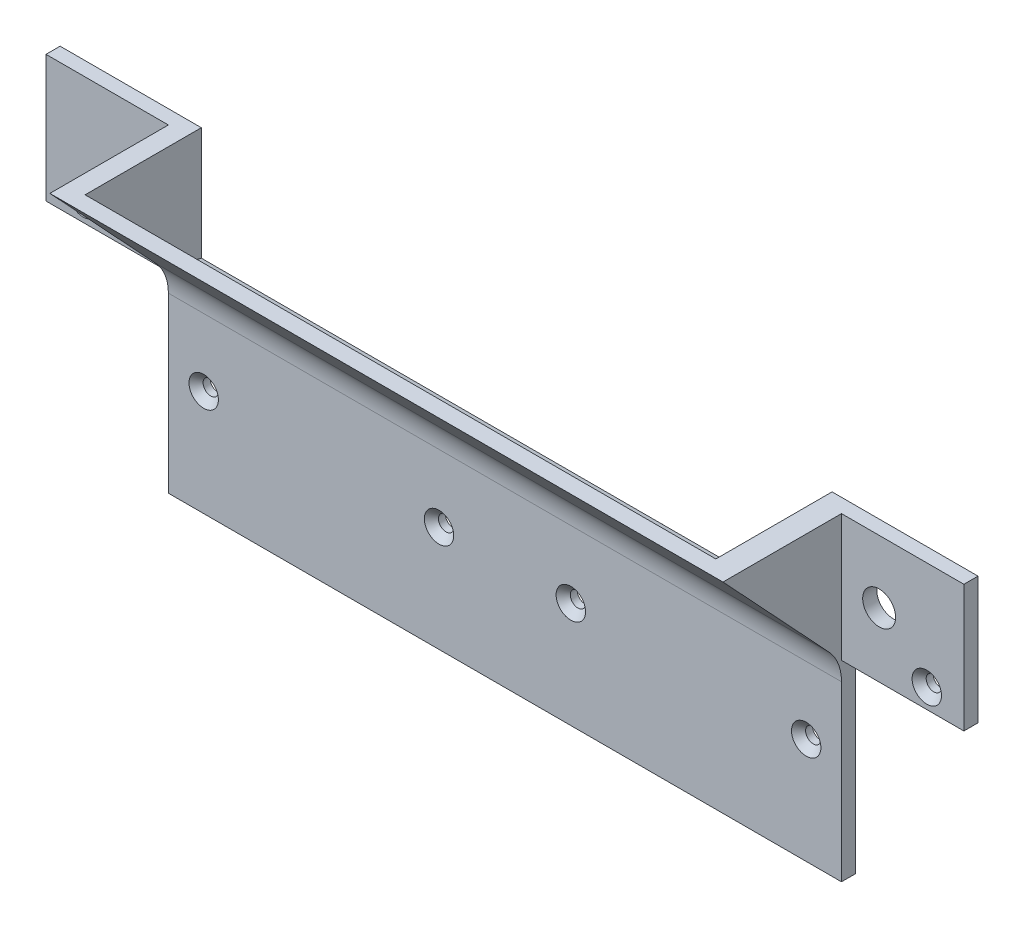
from build123d import *

# Parameters (mm, degrees)
CROQUIS1_R                  = 1.625
SALIENTE_EXTRUIR1_DEPTH     = 3
CROQUIS2_W                  = 143
CROQUIS2_H                  = 24
SALIENTE_EXTRUIR2_DEPTH     = 13
CORTAR_EXTRUIR1_START       = -4
CORTAR_EXTRUIR1_DEPTH       = 134
CORTAR_EXTRUIR2_DEPTH       = 183.316345948
CORTAR_EXTRUIR2_DEPTH_BACK  = 183.316345948
SALIENTE_EXTRUIR3_DEPTH     = 1
CHAFL_N1_SIZE               = 1.5
CROQUIS7_R                  = 6
CORTAR_EXTRUIR3_DEPTH       = 10
CROQUIS11_R                 = 5
CORTAR_EXTRUIR7_DEPTH       = 60
CORTAR_EXTRUIR8_DEPTH       = 183.40682554
CORTAR_EXTRUIR8_DEPTH_BACK  = 183.40682554
CROQUIS12_W                 = 39.754544999
CROQUIS12_H                 = 27.919936099
CORTAR_EXTRUIR9_DEPTH       = 119.057189531
CORTAR_EXTRUIR9_DEPTH_BACK  = 119.057189531
CROQUIS13_W                 = 134.117881028
CROQUIS13_H                 = 3.734427539
CORTAR_EXTRUIR10_DEPTH      = 207.049144623
CORTAR_EXTRUIR10_DEPTH_BACK = 207.049144623
CROQUIS14_W                 = 4.069621889
CROQUIS14_H                 = 4.224509549
CROQUIS22_W                 = 31
CROQUIS22_H                 = 6.734427539
SALIENTE_EXTRUIR9_DEPTH     = 3
CROQUIS23_W                 = 15.138367264
CROQUIS23_H                 = 34.152206442
CORTAR_EXTRUIR11_DEPTH      = 10
SALIENTE_EXTRUIR4_START     = -5
SALIENTE_EXTRUIR4_DEPTH     = 5
SALIENTE_EXTRUIR5_START     = -4
SALIENTE_EXTRUIR5_DEPTH     = 4
SALIENTE_EXTRUIR6_START     = -138
SALIENTE_EXTRUIR6_DEPTH     = 134
CROQUIS18_R                 = 6
SALIENTE_EXTRUIR7_DEPTH     = 3
REDONDEO1_R                 = 10
CROQUIS19_R                 = 5
CROQUIS19_R_2               = 3.25
CROQUIS19_R_3               = 3.5
SALIENTE_EXTRUIR8_DEPTH     = 3


with BuildPart() as part:
    # Croquis1 → Saliente-Extruir1 (new body)
    with BuildSketch(Plane.XY):
        Polygon((-97.5, -1.75), (-97.5, -25.75), (-71.5, -25.75), (-71.5, -66.5), (71.5, -66.5), (71.5, -25.75), (97.5, -25.75), (97.5, -1.75), align=None)
        with Locations((-89.62, -21.62)):
            Circle(CROQUIS1_R, mode=Mode.SUBTRACT)
        with Locations((-64, -44)):
            Circle(CROQUIS1_R, mode=Mode.SUBTRACT)
        with Locations((-14, -44)):
            Circle(CROQUIS1_R, mode=Mode.SUBTRACT)
        with Locations(Location((14, -44, 0), (0, 0, 180))):
            Circle(CROQUIS1_R, mode=Mode.SUBTRACT)
        with Locations(Location((64, -44, 0), (0, 0, 180))):
            Circle(CROQUIS1_R, mode=Mode.SUBTRACT)
        with Locations(Location((89.62, -21.62, 0), (0, 0, 180))):
            Circle(CROQUIS1_R, mode=Mode.SUBTRACT)
    extrude(amount=SALIENTE_EXTRUIR1_DEPTH)

    # Croquis2 → Saliente-Extruir2 (add)
    with BuildSketch(Plane.XY.offset(3)):
        with Locations((0, -13.75)):
            Rectangle(CROQUIS2_W, CROQUIS2_H)
    extrude(amount=SALIENTE_EXTRUIR2_DEPTH)

    # Croquis4 → Cortar-Extruir1 (cut)
    with BuildSketch(Plane.ZY.offset(71.5).offset(CORTAR_EXTRUIR1_START)):
        Polygon((0, -22.75), (12.254442441, -19.75), (12.254442441, -7.75), (0, -4.75), align=None)
    extrude(amount=-CORTAR_EXTRUIR1_DEPTH, mode=Mode.SUBTRACT)

    # Croquis5 → Cortar-Extruir2 (cut, two sides: drawn at the far end of the back side and taken through both)
    with BuildSketch(Plane.ZY.offset(71.5).offset(-CORTAR_EXTRUIR2_DEPTH_BACK)):
        Polygon((3, -25.75), (16, -22.567480666), (16, -5.666946873), (0, -1.75), (13.126652557, 3.411104472), (22.490929508, -3.111277484), (22.490929508, -28.232984682), align=None)
    extrude(amount=CORTAR_EXTRUIR2_DEPTH + CORTAR_EXTRUIR2_DEPTH_BACK, mode=Mode.SUBTRACT)

    # Croquis6 → Saliente-Extruir3 (add)
    # profile 1 of 3: a face of its own
    with BuildSketch(Plane.XY.offset(16)):
        with BuildLine():
            Line((-11.048076923, -8.067480666), (-8.963942308, -8.067480666))
            add(Edge.make_bspline(
                [(-8.963942308, -8.067480666), (-8.809276988, -8.068112716), (-8.511063659, -8.069331385), (-8.082223191, -8.086660848), (-7.688620597, -8.112805667), (-7.330723888, -8.147308935), (-7.008234257, -8.195180289), (-6.72182234, -8.25265944), (-6.469658762, -8.316670483), (-6.318437154, -8.376153718), (-6.247596154, -8.404019127)],
                knots=[0, 0, 0, 0, 1.348808202, 2.600664361, 3.742342956, 4.788858012, 5.735658768, 6.584006912, 7.336666444, 8, 8, 8, 8], degree=3))
            add(Edge.make_bspline(
                [(-6.247596154, -8.404019127), (-6.167838297, -8.439986111), (-6.01192431, -8.510295871), (-5.788508653, -8.62947523), (-5.57929728, -8.757863745), (-5.387757493, -8.900302082), (-5.209847212, -9.050792623), (-5.046669639, -9.210766732), (-4.899538696, -9.382679515), (-4.766910273, -9.563447492), (-4.648977655, -9.752836862), (-4.547744652, -9.951781558), (-4.460210228, -10.158597262), (-4.391853098, -10.375534491), (-4.335040106, -10.599989157), (-4.298295523, -10.833377416), (-4.27243642, -11.07491201), (-4.270311593, -11.238882429), (-4.269230769, -11.322288358)],
                knots=[0, 0, 0, 0, 1.116361014, 2.182309107, 3.229450697, 4.24598407, 5.225421932, 6.201651319, 7.158895679, 8.110002388, 9.060669178, 10.002827475, 10.956240434, 11.923213192, 12.902917952, 13.908279153, 14.936015885, 16, 16, 16, 16], degree=3))
            add(Edge.make_bspline(
                [(-4.269230769, -11.322288358), (-4.271772595, -11.424925094), (-4.276790571, -11.627546629), (-4.309579081, -11.926339339), (-4.370733726, -12.213061963), (-4.453090589, -12.488617706), (-4.555124128, -12.754790758), (-4.686709728, -13.006949511), (-4.838806317, -13.249487522), (-5.014462356, -13.47922496), (-5.210800272, -13.698269295), (-5.437501776, -13.893729522), (-5.68202542, -14.078750894), (-5.954416581, -14.240928545), (-6.247183828, -14.39157714), (-6.567004768, -14.519215786), (-6.907876863, -14.637006555), (-7.14689016, -14.695959195), (-7.269230769, -14.726134512)],
                knots=[0, 0, 0, 0, 0.995453645, 1.965186658, 2.910129054, 3.83459069, 4.752398018, 5.669942118, 6.588407184, 7.525617038, 8.471772905, 9.435289717, 10.423772802, 11.441988612, 12.505459691, 13.613754905, 14.778583949, 16, 16, 16, 16], degree=3))
            Line((-7.269230769, -14.726134512), (-4.5, -20.067480666))
            Line((-4.5, -20.067480666), (-6.90625, -20.067480666))
            Line((-6.90625, -20.067480666), (-9.617788462, -14.836711435))
            Line((-9.617788462, -14.836711435), (-9.822115385, -14.836711435))
            Line((-9.822115385, -14.836711435), (-10.557692308, -20.067480666))
            Line((-10.557692308, -20.067480666), (-12.730769231, -20.067480666))
            Line((-12.730769231, -20.067480666), (-11.048076923, -8.067480666))
        make_face()
        with BuildLine():
            add(Edge.make_bspline(
                [(-9.540865385, -12.836711435), (-9.386195416, -12.835275241), (-9.090350679, -12.832528164), (-8.667825913, -12.813420248), (-8.28680605, -12.783236682), (-7.948389952, -12.740102395), (-7.651687406, -12.689090143), (-7.397958815, -12.625404989), (-7.186041205, -12.549684501), (-7.012592097, -12.459887562), (-6.872086372, -12.354457197), (-6.750472631, -12.241946473), (-6.649207312, -12.116003172), (-6.565654347, -11.978741621), (-6.5012127, -11.829877316), (-6.454740309, -11.668401722), (-6.429045355, -11.495391495), (-6.425095306, -11.376054994), (-6.423076923, -11.31507682)],
                knots=[0, 0, 0, 0, 1.892208387, 3.619318591, 5.173427176, 6.566868293, 7.791773198, 8.8545744, 9.763297566, 10.539470204, 11.233547833, 11.906251103, 12.5615143, 13.203742025, 13.866659999, 14.539934446, 15.25394049, 16, 16, 16, 16], degree=3))
            add(Edge.make_bspline(
                [(-6.423076923, -11.31507682), (-6.425689641, -11.245936375), (-6.430757957, -11.11181339), (-6.474596815, -10.918637614), (-6.549559753, -10.743400948), (-6.654909947, -10.587778732), (-6.786381326, -10.450558767), (-6.946769202, -10.337542298), (-7.134240875, -10.248576591), (-7.309857115, -10.189799645), (-7.476087089, -10.155754532), (-7.631045454, -10.132880777), (-7.814511833, -10.110808419), (-8.027038079, -10.094486606), (-8.26836871, -10.083690031), (-8.538380856, -10.073198835), (-8.836529796, -10.069468107), (-9.044872334, -10.068163199), (-9.153846154, -10.067480666)],
                knots=[0, 0, 0, 0, 0.974340854, 1.890087692, 2.776057671, 3.647490651, 4.526730822, 5.442477659, 6.397820337, 7.445016909, 8.045730266, 8.789007992, 9.653967296, 10.651691253, 11.794598421, 13.061237498, 14.462876682, 16, 16, 16, 16], degree=3))
            Line((-9.153846154, -10.067480666), (-9.540865385, -12.836711435))
        make_face(mode=Mode.SUBTRACT)
    # profile 2 of 3: a face of its own
    with BuildSketch(Plane.XY.offset(16)):
        Polygon((1.884615385, -8.067480666), (4.180288462, -8.067480666), (6.012019231, -12.807865281), (9.425480769, -8.067480666), (12.033653846, -8.067480666), (6.838942308, -15.28382682), (6.209134615, -20.067480666), (4.038461538, -20.067480666), (4.670673077, -15.271807589), align=None)
    # profile 3 of 3: a face of its own
    with BuildSketch(Plane.XY.offset(16)):
        with BuildLine():
            add(Edge.make_bspline(
                [(24.487980769, -7.759788358), (24.690145883, -7.764031221), (25.087091072, -7.772361955), (25.668927957, -7.849024893), (26.224011967, -7.972589701), (26.750990661, -8.149778703), (27.251887383, -8.373625801), (27.725496832, -8.64948879), (28.171301864, -8.975420649), (28.585672586, -9.347005104), (28.961013577, -9.756424421), (29.293862045, -10.194630861), (29.570289093, -10.663617643), (29.797934343, -11.158162459), (29.977385898, -11.67880605), (30.099797668, -12.228050386), (30.180599156, -12.802256134), (30.188356974, -13.194600078), (30.192307692, -13.394403743)],
                knots=[0, 0, 0, 0, 1.079937363, 2.120424901, 3.130164457, 4.114608815, 5.086352068, 6.057283592, 7.037967613, 8.032612779, 9.026667848, 10.002130715, 10.967845321, 11.92966918, 12.907375778, 13.904589319, 14.932898699, 16, 16, 16, 16], degree=3))
            add(Edge.make_bspline(
                [(30.192307692, -13.394403743), (30.189777514, -13.549969057), (30.184745184, -13.859376411), (30.136860197, -14.319433848), (30.062261858, -14.772962365), (29.960118985, -15.22009286), (29.823390606, -15.659391242), (29.660180669, -16.093460312), (29.46547734, -16.520524116), (29.241871054, -16.937274794), (28.996915489, -17.338803359), (28.7284292, -17.718478392), (28.439993147, -18.074046587), (28.132714318, -18.406907786), (27.803274713, -18.712605848), (27.458113362, -18.997544901), (27.089752961, -19.255248214), (26.704041226, -19.490638964), (26.300172025, -19.699838611), (25.880874397, -19.880651571), (25.446694054, -20.031827723), (24.998656183, -20.156810905), (24.535654153, -20.256242446), (24.057773688, -20.324929749), (23.564847151, -20.366615352), (23.231652765, -20.37229141), (23.0625, -20.375172973)],
                knots=[0, 0, 0, 0, 1.005311864, 1.999487392, 2.986390894, 3.975195422, 4.961487101, 5.958115224, 6.97104375, 7.992937587, 9.013623077, 10.009524137, 10.996414046, 11.971324635, 12.935123389, 13.899409138, 14.862205298, 15.838449601, 16.81836937, 17.799766407, 18.787539403, 19.787875373, 20.804768927, 21.846385261, 22.906674593, 24, 24, 24, 24], degree=3))
            add(Edge.make_bspline(
                [(23.0625, -20.375172973), (22.853135899, -20.370858389), (22.444328213, -20.362433662), (21.848518981, -20.288026789), (21.284795586, -20.171851994), (20.753132043, -20.005539058), (20.252537915, -19.791081257), (19.784665176, -19.527933243), (19.348368226, -19.218964103), (18.95096102, -18.86198382), (18.589596339, -18.470409943), (18.279289135, -18.040986521), (18.01132057, -17.585306791), (17.798725719, -17.095904155), (17.628612138, -16.578784265), (17.510091564, -16.030972392), (17.435973691, -15.453330543), (17.427441159, -15.058097005), (17.423076923, -14.855942204)],
                knots=[0, 0, 0, 0, 1.129126937, 2.20475128, 3.23403939, 4.230775744, 5.204839333, 6.16680792, 7.121629951, 8.083044708, 9.04383724, 9.990659777, 10.936010704, 11.890255174, 12.863608629, 13.868449271, 14.909750384, 16, 16, 16, 16], degree=3))
            add(Edge.make_bspline(
                [(17.423076923, -14.855942204), (17.428320242, -14.624869771), (17.438644619, -14.169875797), (17.52940159, -13.500129748), (17.668126056, -12.853643656), (17.872529982, -12.233852573), (18.130311731, -11.638404639), (18.447815919, -11.06928239), (18.820122992, -10.521870887), (19.110384087, -10.185000587), (19.257211538, -10.01459605)],
                knots=[0, 0, 0, 0, 1.045740506, 2.05911896, 3.05467723, 4.035585325, 5.008815224, 5.988058098, 6.982266978, 8, 8, 8, 8], degree=3))
            add(Edge.make_bspline(
                [(19.257211538, -10.01459605), (19.342684328, -9.922203908), (19.51209099, -9.739083119), (19.783215845, -9.484603753), (20.06097764, -9.246349173), (20.349308035, -9.027147767), (20.643852388, -8.821908403), (20.949304268, -8.637099729), (21.264508226, -8.470716347), (21.586036115, -8.318996359), (21.919420196, -8.189450626), (22.258897756, -8.073377572), (22.609179935, -7.977606464), (22.967797996, -7.898338686), (23.335095226, -7.835310389), (23.711559619, -7.793010431), (24.096550714, -7.765636615), (24.356523498, -7.761752428), (24.487980769, -7.759788358)],
                knots=[0, 0, 0, 0, 1.027812829, 2.037120149, 3.035266778, 4.015768311, 4.994345575, 5.966422343, 6.929711672, 7.904780536, 8.86860337, 9.849672715, 10.834163809, 11.833018336, 12.848777673, 13.876590502, 14.926281379, 16, 16, 16, 16], degree=3))
        make_face()
        with BuildLine():
            add(Edge.make_bspline(
                [(24.4375, -9.759788358), (24.328447387, -9.761418674), (24.111488075, -9.764662176), (23.790362866, -9.797280367), (23.475697903, -9.847819491), (23.168815306, -9.917080446), (22.868242731, -10.006469212), (22.576026578, -10.116936735), (22.290007834, -10.247670757), (22.013339819, -10.398523989), (21.745094417, -10.566746314), (21.490872977, -10.754485143), (21.248887858, -10.959052925), (21.023212093, -11.18405633), (20.808889976, -11.424872132), (20.606521464, -11.681986732), (20.418634071, -11.957904331), (20.244392114, -12.248035341), (20.089720762, -12.550000292), (19.952338208, -12.854508864), (19.835416748, -13.161604404), (19.742691091, -13.472121892), (19.666996063, -13.784816529), (19.614508511, -14.100512176), (19.581919, -14.418547712), (19.578590145, -14.63150578), (19.576923077, -14.738153743)],
                knots=[0, 0, 0, 0, 1.015557909, 2.02044445, 3.003357477, 3.982977463, 4.948851735, 5.922052592, 6.890662853, 7.875953625, 8.855459861, 9.837777552, 10.817397539, 11.804383193, 12.803598646, 13.818964529, 14.849984807, 15.911175445, 16.969421976, 18.008462528, 19.021851172, 20.027762868, 21.025304218, 22.016795393, 23.006824523, 24, 24, 24, 24], degree=3))
            add(Edge.make_bspline(
                [(19.576923077, -14.738153743), (19.579554921, -14.862493068), (19.584733218, -15.107137502), (19.62985602, -15.46726908), (19.699769416, -15.813989217), (19.805563564, -16.144424323), (19.934112881, -16.462147128), (20.097326515, -16.762409031), (20.284948891, -17.051147187), (20.503012874, -17.321027274), (20.746578093, -17.570198979), (21.021361871, -17.785169726), (21.320372429, -17.968728653), (21.644893978, -18.118096904), (21.994659132, -18.234678513), (22.370567325, -18.313898162), (22.770964471, -18.366393766), (23.046299029, -18.372196918), (23.1875, -18.375172973)],
                knots=[0, 0, 0, 0, 1.032572517, 2.031642993, 3.01079972, 3.966643664, 4.909863955, 5.853952978, 6.801111379, 7.766917104, 8.731873648, 9.689385086, 10.65752794, 11.640388645, 12.650815691, 13.713650281, 14.827481725, 16, 16, 16, 16], degree=3))
            add(Edge.make_bspline(
                [(23.1875, -18.375172973), (23.352788185, -18.371267675), (23.679167101, -18.363556252), (24.158560502, -18.294872985), (24.618756292, -18.180856063), (25.059793976, -18.025050504), (25.481815634, -17.823391072), (25.884831734, -17.577269923), (26.267802401, -17.284339207), (26.627646907, -16.95226102), (26.958207141, -16.589806943), (27.247161365, -16.20243939), (27.492552605, -15.795258336), (27.692480371, -15.369154171), (27.847171329, -14.923409671), (27.957444954, -14.458807988), (28.027034101, -13.975037009), (28.03462008, -13.645441832), (28.038461538, -13.478538358)],
                knots=[0, 0, 0, 0, 1.03369803, 2.041145535, 3.022357397, 3.995919545, 4.96236968, 5.943376615, 6.945032455, 7.973917545, 9.003120129, 10.009769043, 10.992465341, 11.972511115, 12.949140339, 13.93890809, 14.956285095, 16, 16, 16, 16], degree=3))
            add(Edge.make_bspline(
                [(28.038461538, -13.478538358), (28.036245406, -13.341360283), (28.031902288, -13.072522213), (27.981755136, -12.68105056), (27.905579854, -12.310002908), (27.798497608, -11.959493941), (27.654266016, -11.631495582), (27.485057282, -11.321970211), (27.280132488, -11.03616901), (27.047907563, -10.773147054), (26.79116339, -10.534153573), (26.511117013, -10.328091437), (26.213858009, -10.149180232), (25.894302371, -10.00960188), (25.558232415, -9.89383052), (25.201686968, -9.815996795), (24.825727742, -9.770032092), (24.569043318, -9.763259245), (24.4375, -9.759788358)],
                knots=[0, 0, 0, 0, 1.12845219, 2.211511647, 3.242392028, 4.243671568, 5.221368115, 6.186708094, 7.141970352, 8.109200861, 9.070590294, 10.022934043, 10.966237583, 11.91979086, 12.887493425, 13.887534174, 14.917422563, 16, 16, 16, 16], degree=3))
        make_face(mode=Mode.SUBTRACT)
    extrude(amount=SALIENTE_EXTRUIR3_DEPTH)

    # Chaflán1
    chafl_n1_edges = [part.edges().sort_by_distance(p)[0] for p in [
        (-91.245, -21.62, 3),
        (-65.625, -44, 3),
        (-15.625, -44, 3),
        (15.625, -44, 3),
        (65.625, -44, 3),
        (91.245, -21.62, 3),
    ]]
    chamfer(chafl_n1_edges, length=CHAFL_N1_SIZE)

    # Croquis7 → Cortar-Extruir3 (cut)
    with BuildSketch(Plane.XY.offset(3)):
        with Locations((0, -33.75)):
            Circle(CROQUIS7_R)
    extrude(amount=-CORTAR_EXTRUIR3_DEPTH, mode=Mode.SUBTRACT)

    # Croquis11 → Cortar-Extruir7 (cut)
    with BuildSketch(Plane.XY.offset(3)):
        with Locations((-79.5, -12.1)):
            Circle(CROQUIS11_R)
        with Locations(Location((79.5, -12.1, 0), (0, 0, 180))):
            Circle(CROQUIS11_R)
    extrude(amount=-CORTAR_EXTRUIR7_DEPTH, mode=Mode.SUBTRACT)

    # Croquis12 → Cortar-Extruir8 (cut, two sides: drawn at the far end of the back side and taken through both)
    with BuildSketch(Plane(origin=(71.5, 0, 0), x_dir=(0, 0, -1), z_dir=(1, 0, 0)).offset(-CORTAR_EXTRUIR8_DEPTH_BACK)):
        with Locations((-22.8772725, -11.79003195)):
            Rectangle(CROQUIS12_W, CROQUIS12_H)
    extrude(amount=CORTAR_EXTRUIR8_DEPTH + CORTAR_EXTRUIR8_DEPTH_BACK, mode=Mode.SUBTRACT)

    # Croquis13 → Cortar-Extruir9 (cut, two sides: drawn at the far end of the back side and taken through both)
    with BuildSketch(Plane.XY.offset(3).offset(-CORTAR_EXTRUIR9_DEPTH_BACK)):
        with Locations((-0.441059486, -3.61721377)):
            Rectangle(CROQUIS13_W, CROQUIS13_H)
    extrude(amount=CORTAR_EXTRUIR9_DEPTH + CORTAR_EXTRUIR9_DEPTH_BACK, mode=Mode.SUBTRACT)

    # Croquis14 → Cortar-Extruir10 (cut, two sides: drawn at the far end of the back side and taken through both)
    with BuildSketch(Plane(origin=(97.5, 0, 0), x_dir=(0, 0, -1), z_dir=(1, 0, 0)).offset(-CORTAR_EXTRUIR10_DEPTH_BACK)):
        with Locations((-0.965189056, -0.372172765)):
            Rectangle(CROQUIS14_W, CROQUIS14_H)
    extrude(amount=CORTAR_EXTRUIR10_DEPTH + CORTAR_EXTRUIR10_DEPTH_BACK, mode=Mode.SUBTRACT)

    # Croquis22 → Saliente-Extruir9 (add)
    with BuildSketch(Plane.XY.offset(3)):
        with Locations((82, -2.11721377)):
            Rectangle(CROQUIS22_W, CROQUIS22_H)
        with Locations((-82, -2.11721377)):
            Rectangle(CROQUIS22_W, CROQUIS22_H)
    extrude(amount=-SALIENTE_EXTRUIR9_DEPTH)

    # Croquis23 → Cortar-Extruir11 (cut)
    with BuildSketch(Plane.XY.offset(3)):
        with Locations((-59.930816368, 11.591675682)):
            Rectangle(CROQUIS23_W, CROQUIS23_H)
    extrude(amount=-CORTAR_EXTRUIR11_DEPTH, mode=Mode.SUBTRACT)

    # Croquis15 → Saliente-Extruir4 (add)
    with BuildSketch(Plane(origin=(71.5, 0, 0), x_dir=(0, 0, -1), z_dir=(1, 0, 0)).offset(SALIENTE_EXTRUIR4_START)):
        Polygon((-3, -25.75), (-28.175174424, 1.25), (-3, 1.25), align=None)
    extrude(amount=SALIENTE_EXTRUIR4_DEPTH)

    # Croquis16 → Saliente-Extruir5 (add)
    with BuildSketch(Plane.ZY.offset(71.5).offset(SALIENTE_EXTRUIR5_START)):
        Polygon((3, 1.25), (28.175174424, 1.25), (3, -25.75), align=None)
    extrude(amount=SALIENTE_EXTRUIR5_DEPTH)

    # Croquis17 → Saliente-Extruir6 (add)
    with BuildSketch(Plane.ZY.offset(71.5).offset(SALIENTE_EXTRUIR6_START)):
        Polygon((3, -22.015572461), (24.6931424, 1.25), (28.175174424, 1.25), (3, -25.75), align=None)
    extrude(amount=SALIENTE_EXTRUIR6_DEPTH)

    # Croquis18 → Saliente-Extruir7 (add)
    with BuildSketch(Plane.XY.offset(3)):
        with Locations((0, -33.75)):
            Circle(CROQUIS18_R)
    extrude(amount=-SALIENTE_EXTRUIR7_DEPTH)

    # Redondeo1
    # the kernel refuses this fillet: 10 mm, written as the material it adds along each edge
    with BuildSketch(Plane(origin=(-71.5, -25.75, 3), x_dir=(0, 0.731390625538099, 0.6819587618580675), z_dir=(1, 0, 0))) as redondeo1_piece_1:
        with BuildLine():
            CenterArc((REDONDEO1_R * 0.393879204265, REDONDEO1_R), REDONDEO1_R, 227.003102128, 42.996897872)
            Line((-REDONDEO1_R * 0.288079557594, REDONDEO1_R * 0.268609374462), (0, 0))
            Line((0, 0), (REDONDEO1_R * 0.393879204265, 0))
        make_face()
    extrude(amount=143)

    # Croquis19 → Saliente-Extruir8 (add)
    # profile 1 of 2: a face of its own
    with BuildSketch(Plane.XY.offset(3)):
        with Locations((-79.5, -12.1)):
            Circle(CROQUIS19_R)
        with Locations((-79.5, -12.1)):
            Circle(CROQUIS19_R_2, mode=Mode.SUBTRACT)
    # profile 2 of 2: a face of its own
    with BuildSketch(Plane.XY.offset(3)):
        with Locations((79.5, -12.1)):
            Circle(CROQUIS19_R)
        with Locations((79.5, -12.1)):
            Circle(CROQUIS19_R_3, mode=Mode.SUBTRACT)
    extrude(amount=-SALIENTE_EXTRUIR8_DEPTH)


solid = part.part
